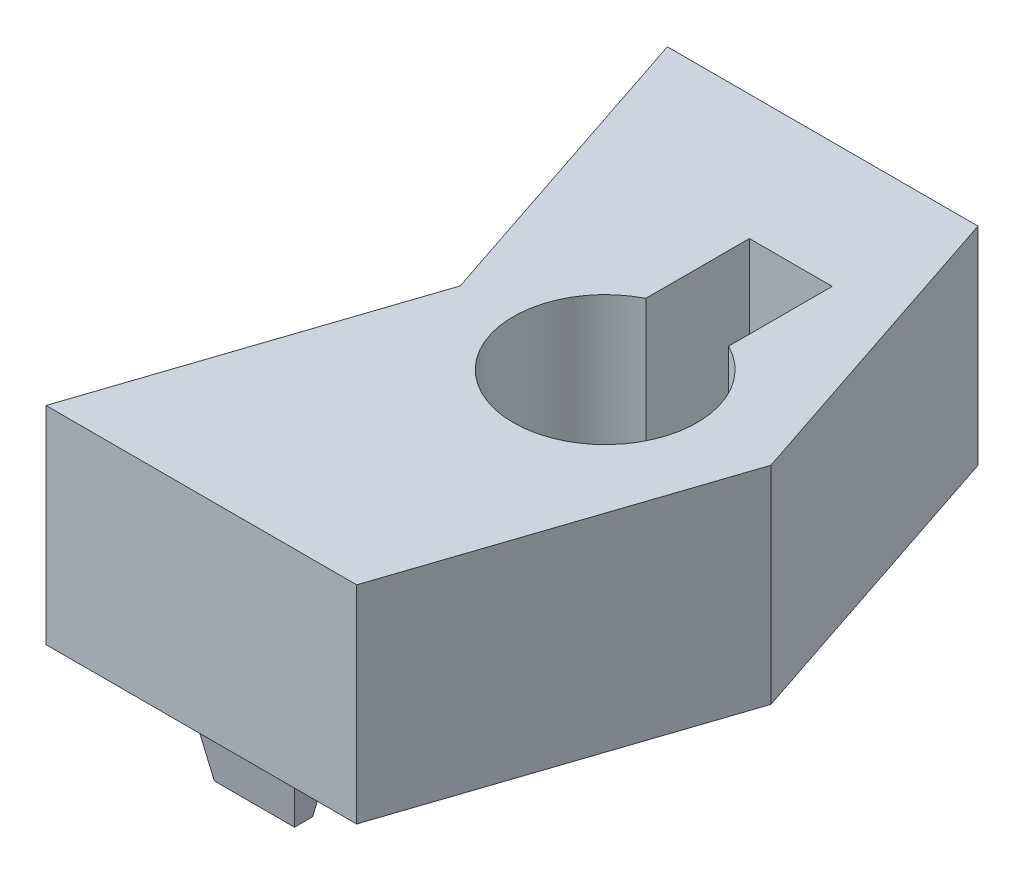
from build123d import *

# Parameters (mm, degrees)
BOSS_EXTRUDE1_DEPTH       = 12.7
SKETCH2_R                 = 5.635000033
HAPTIC_MOTOR_CUTOUT_DEPTH = 9.557999934
SKETCH3_W                 = 5.08
SKETCH3_H                 = 6.35
HAPTIC_WIRE_CUTOUT_DEPTH  = 48.519048812
SKETCH4_W                 = 6.35
SKETCH4_H                 = 2.54
PINS_DEPTH                = 4.064
PINS_TAPER                = 10


with BuildPart() as part:
    # Sketch1 → Boss-Extrude1 (new body)
    with BuildSketch(Plane(origin=(0, 0, 0), x_dir=(1, 0, 0), z_dir=(0, 1, 0))):
        Polygon((0, 0), (19.05, 0), (25.4, 19.05), (19.05, 38.1), (0, 38.1), (6.35, 19.05), align=None)
    extrude(amount=BOSS_EXTRUDE1_DEPTH)

    # Sketch2 → Haptic Motor Cutout (cut)
    with BuildSketch(Plane.XZ.offset(-12.7)):
        with Locations((15.24, -19.05)):
            Circle(SKETCH2_R)
    extrude(amount=HAPTIC_MOTOR_CUTOUT_DEPTH, mode=Mode.SUBTRACT)

    # Sketch3 → Haptic Wire Cutout (cut, through all)
    with BuildSketch(Plane.XZ):
        with Locations((15.24, -27.255072104)):
            Rectangle(SKETCH3_W, SKETCH3_H)
    extrude(amount=-HAPTIC_WIRE_CUTOUT_DEPTH, mode=Mode.SUBTRACT)

    # Sketch4 → Pins (add)
    with BuildSketch(Plane.XZ):
        with Locations((10.795, -35.56)):
            Rectangle(SKETCH4_W, SKETCH4_H)
    pins = extrude(amount=PINS_DEPTH, taper=PINS_TAPER)

    # Mirror1: Pins across plane
    add(pins.mirror(Plane(origin=(0, 0, -19.05), x_dir=(1, 0, 0), z_dir=(0, 0, -1))))


solid = part.part
